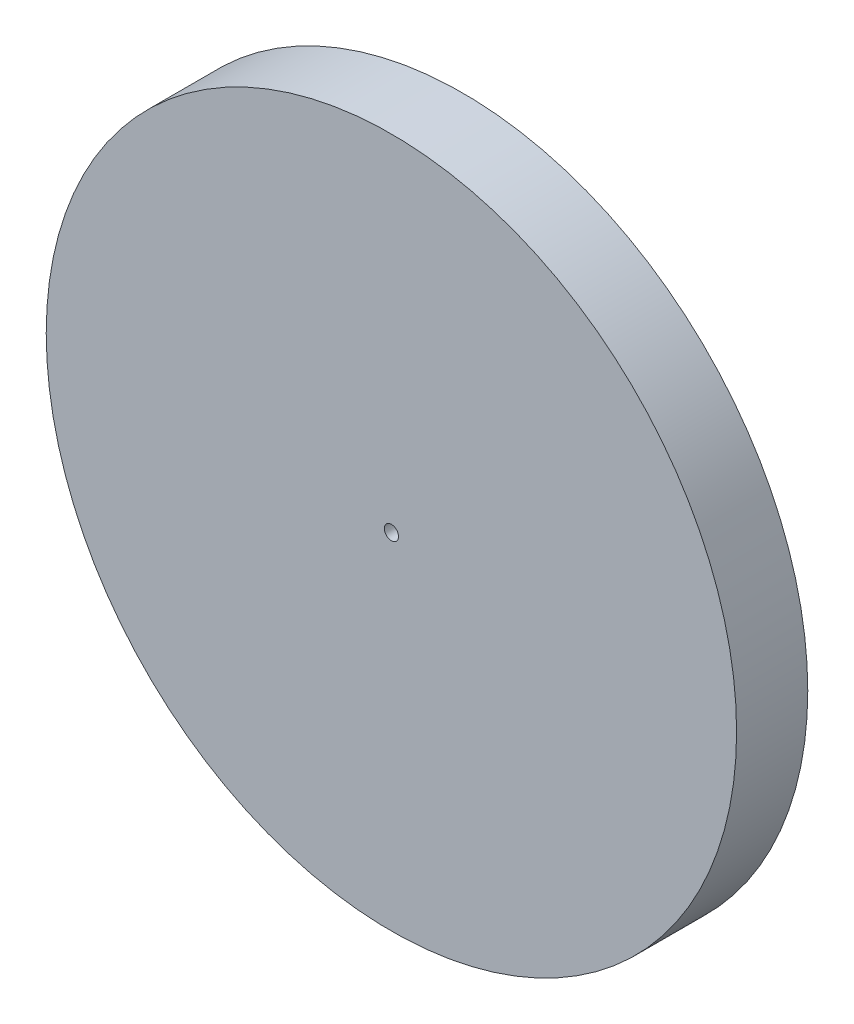
from build123d import *

# Parameters (mm, degrees)
SKETCH1_R           = 48.5
SKETCH1_R_2         = 1
BOSS_EXTRUDE1_DEPTH = 10


with BuildPart() as part:
    # Sketch1 → Boss-Extrude1 (new body)
    with BuildSketch(Plane.XY):
        Circle(SKETCH1_R)
        Circle(SKETCH1_R_2, mode=Mode.SUBTRACT)
    extrude(amount=BOSS_EXTRUDE1_DEPTH)


solid = part.part
